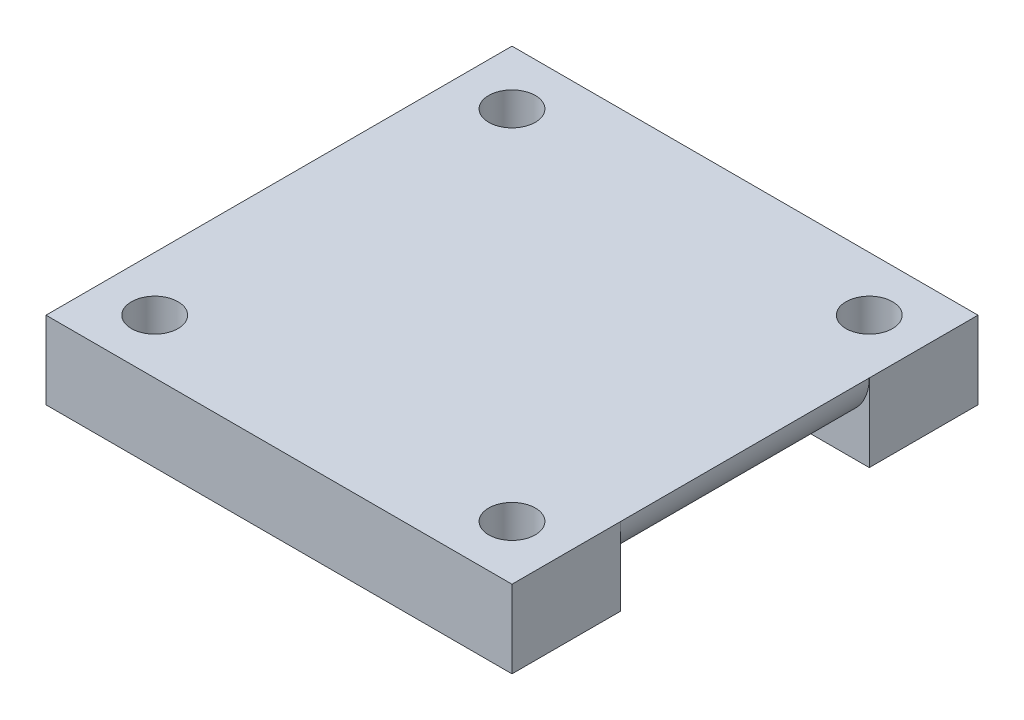
from build123d import *

# Parameters (mm, degrees)
SKETCH1_W           = 30
SKETCH1_H           = 16
SKETCH1_H_2         = 7
SKETCH1_R           = 1.5
BOSS_EXTRUDE1_DEPTH = 5
SKETCH1_3_W         = 30
SKETCH1_3_H         = 16
CUT_EXTRUDE1_DEPTH  = 2
FILLET1_R           = 3


with BuildPart() as part:
    # Sketch1 → Boss-Extrude1 (new body)
    # profile 1 of 3: a face of its own
    with BuildSketch(Plane(origin=(0, 0, 0), x_dir=(1, 0, 0), z_dir=(0, 1, 0))):
        Rectangle(SKETCH1_W, SKETCH1_H)
    # profile 2 of 3: a face of its own
    with BuildSketch(Plane(origin=(0, 0, 0), x_dir=(1, 0, 0), z_dir=(0, 1, 0))):
        with Locations((0, 11.5)):
            Rectangle(SKETCH1_W, SKETCH1_H_2)
        with Locations(Location((-11.5, 11.5, 0), (0, 0, 270))):
            Circle(SKETCH1_R, mode=Mode.SUBTRACT)
        with Locations(Location((11.5, 11.5, 0), (0, 0, 270))):
            Circle(SKETCH1_R, mode=Mode.SUBTRACT)
    # profile 3 of 3: a face of its own
    with BuildSketch(Plane(origin=(0, 0, 0), x_dir=(1, 0, 0), z_dir=(0, 1, 0))):
        with Locations((0, -11.5)):
            Rectangle(SKETCH1_W, SKETCH1_H_2)
        with Locations(Location((-11.5, -11.5, 0), (0, 0, 270))):
            Circle(SKETCH1_R, mode=Mode.SUBTRACT)
        with Locations(Location((11.5, -11.5, 0), (0, 0, 270))):
            Circle(SKETCH1_R, mode=Mode.SUBTRACT)
    extrude(amount=BOSS_EXTRUDE1_DEPTH)

    # Sketch1<3> → Cut-Extrude1 (cut)
    with BuildSketch(Plane(origin=(0, 0, 0), x_dir=(1, 0, 0), z_dir=(0, 1, 0))):
        Rectangle(SKETCH1_3_W, SKETCH1_3_H)
    extrude(amount=CUT_EXTRUDE1_DEPTH, mode=Mode.SUBTRACT)

    # Fillet1
    fillet1_edges = [part.edges().sort_by_distance(p)[0] for p in [
        (15, 2, 0),
        (-15, 2, 0),
    ]]
    fillet(fillet1_edges, radius=FILLET1_R - 0.0001)  # a hair under: the kernel refuses the full size


solid = part.part
